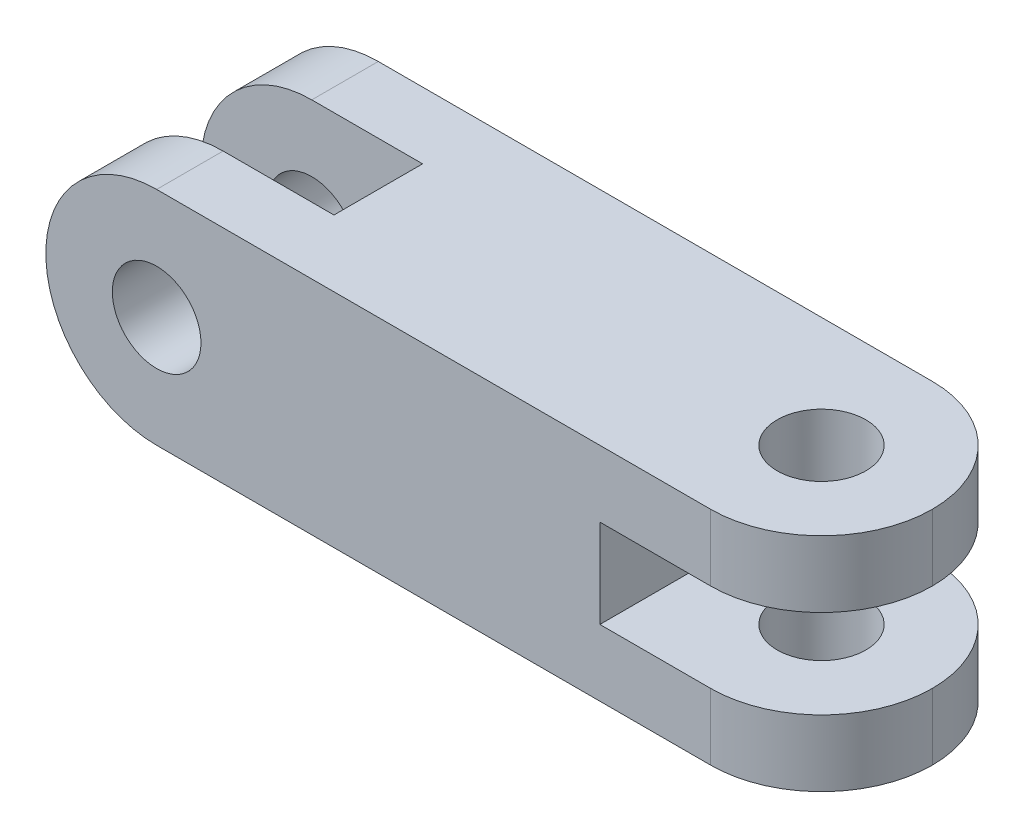
from build123d import *

# Parameters (mm, degrees)
BOSS_EXTRUDE1_DEPTH              = 25
FILLET1_R                        = 25
SKETCH4_W                        = 61.258938573
SKETCH4_H                        = 20
CUT_EXTRUDE1_DEPTH               = 50
SKETCH5_W                        = 61.074850192
SKETCH5_H                        = 20
CUT_EXTRUDE2_DEPTH               = 50
F_20_0MM_DOWEL_HOLE1_D           = 20
F_20_0MM_DOWEL_HOLE1_ON_FACE_2_D = 20


with BuildPart() as part:
    # Sketch1 → Boss-Extrude1 (new, symmetric)
    with BuildSketch(Plane.XY):
        with BuildLine():
            Line((-150, 25), (0, 25))
            Line((0, 25), (0, -25))
            Line((0, -25), (-149.999982985, -25))
            ThreePointArc((-149.999982985, -25), (-174.999982985, -8.507e-06), (-150, 25))
        make_face()
    extrude(amount=BOSS_EXTRUDE1_DEPTH, both=True)

    # Fillet1
    fillet1_edges = [part.edges().sort_by_distance(p)[0] for p in [
        (0, 0, -25),
        (0, 0, 25),
    ]]
    fillet(fillet1_edges, radius=FILLET1_R - 0.0001)  # a hair under: the kernel refuses the full size

    # Sketch4 → Cut-Extrude1 (cut)
    with BuildSketch(Plane(origin=(0, 25, 0), x_dir=(1, 0, 0), z_dir=(0, 1, 0))):
        with Locations((-155.629452272, 0)):
            Rectangle(SKETCH4_W, SKETCH4_H)
    extrude(amount=-CUT_EXTRUDE1_DEPTH, mode=Mode.SUBTRACT)

    # Sketch5 → Cut-Extrude2 (cut)
    with BuildSketch(Plane(origin=(0, 0, -25), x_dir=(-1, 0, 0), z_dir=(0, 0, -1))):
        with Locations((19.462574904, 0)):
            Rectangle(SKETCH5_W, SKETCH5_H)
    extrude(amount=-CUT_EXTRUDE2_DEPTH, mode=Mode.SUBTRACT)

    # Ø20.0mm Dowel Hole1 (through all)
    with Locations(Plane(origin=(-149.999982985, 0, 25), x_dir=(1, 0, 0), z_dir=(0, 0, 1))):
        with Locations((0, 0)):
            Hole(F_20_0MM_DOWEL_HOLE1_D / 2)

    # Ø20.0mm Dowel Hole1 on face 2 (through all)
    with Locations(Plane(origin=(-25, -25, 0), x_dir=(0, 0, -1), z_dir=(0, -1, 0))):
        with Locations((0, 0)):
            Hole(F_20_0MM_DOWEL_HOLE1_ON_FACE_2_D / 2)


solid = part.part
